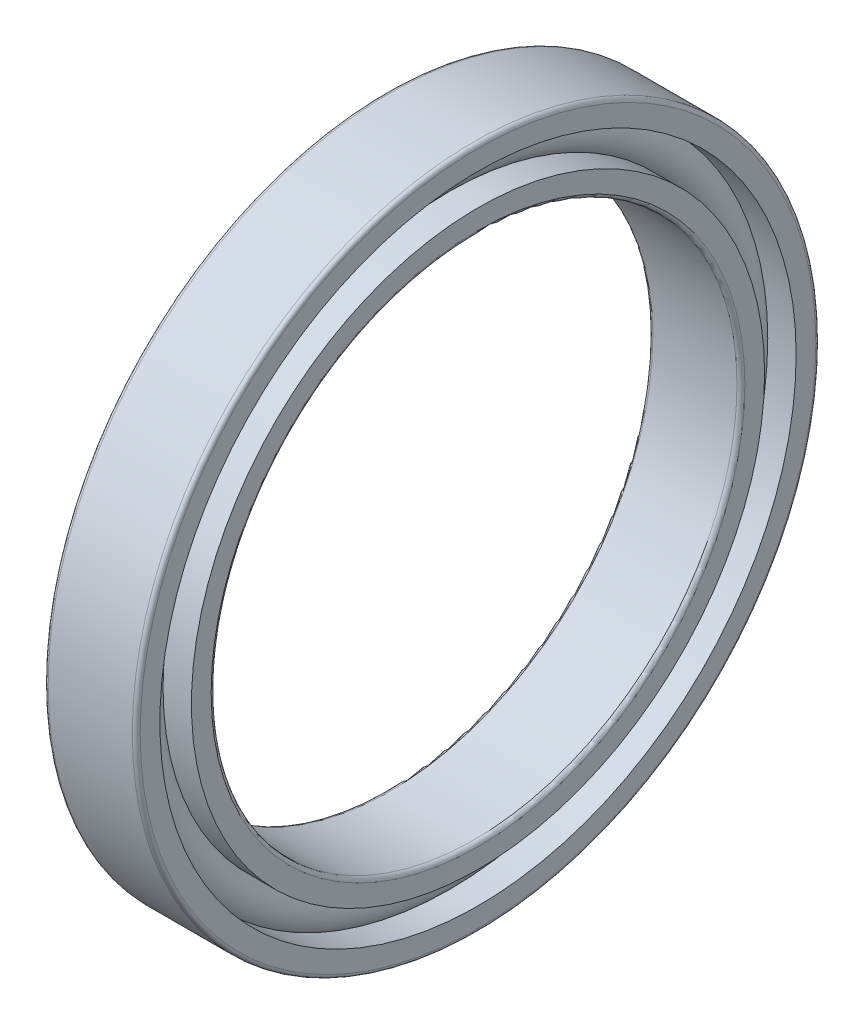
from build123d import *

# Parameters (mm, degrees)
CAGSPISKE_W     = 0.36
CAGSPISKE_H     = 0.6
CAGESPINE_ANGLE = 0.001
BALSIMSKE_R     = 1.8


with BuildPart() as part:
    # CagSpiSke → CageSpine (revolve)
    with BuildSketch(Plane.XY):
        with Locations((0, 23)):
            Rectangle(CAGSPISKE_W, CAGSPISKE_H)
    revolve(axis=Axis((-20.6375, 0, 0), (-1, 0, 0)), revolution_arc=CAGESPINE_ANGLE)

    # BalSimSke → BallsSimplified (revolve)
    with BuildSketch(Plane.XY):
        with Locations((0, 23)):
            Circle(BALSIMSKE_R)
    revolve(axis=Axis((-10, 0, 0), (1, 0, 0)))

    # InnRacSke → InnerRace (revolve)
    with BuildSketch(Plane.XY):
        with BuildLine():
            Line((-1.307908636, 21.8), (-3.5, 21.8))
            Line((-3.5, 21.8), (-3.5, 20.3))
            ThreePointArc((-3.5, 20.3), (-3.412132034, 20.087867966), (-3.2, 20))
            Line((-3.2, 20), (3.2, 20))
            ThreePointArc((3.2, 20), (3.412132034, 20.087867966), (3.5, 20.3))
            Line((3.5, 20.3), (3.5, 21.8))
            Line((3.5, 21.8), (1.307908636, 21.8))
            ThreePointArc((1.307908636, 21.8), (0, 21.225), (-1.307908636, 21.8))
        make_face()
    revolve(axis=Axis((-20.6375, 0, 0), (1, 0, 0)))

    # OutRacSke → OuterRace (revolve)
    with BuildSketch(Plane.XY):
        with BuildLine():
            Line((-1.307908636, 24.2), (-3.5, 24.2))
            Line((-3.5, 24.2), (-3.5, 25.7))
            ThreePointArc((-3.5, 25.7), (-3.412132034, 25.912132034), (-3.2, 26))
            Line((-3.2, 26), (3.2, 26))
            ThreePointArc((3.2, 26), (3.412132034, 25.912132034), (3.5, 25.7))
            Line((3.5, 25.7), (3.5, 24.2))
            Line((3.5, 24.2), (1.307908636, 24.2))
            ThreePointArc((1.307908636, 24.2), (0, 24.775), (-1.307908636, 24.2))
        make_face()
    revolve(axis=Axis((-20.6375, 0, 0), (1, 0, 0)))


solid = part.part
